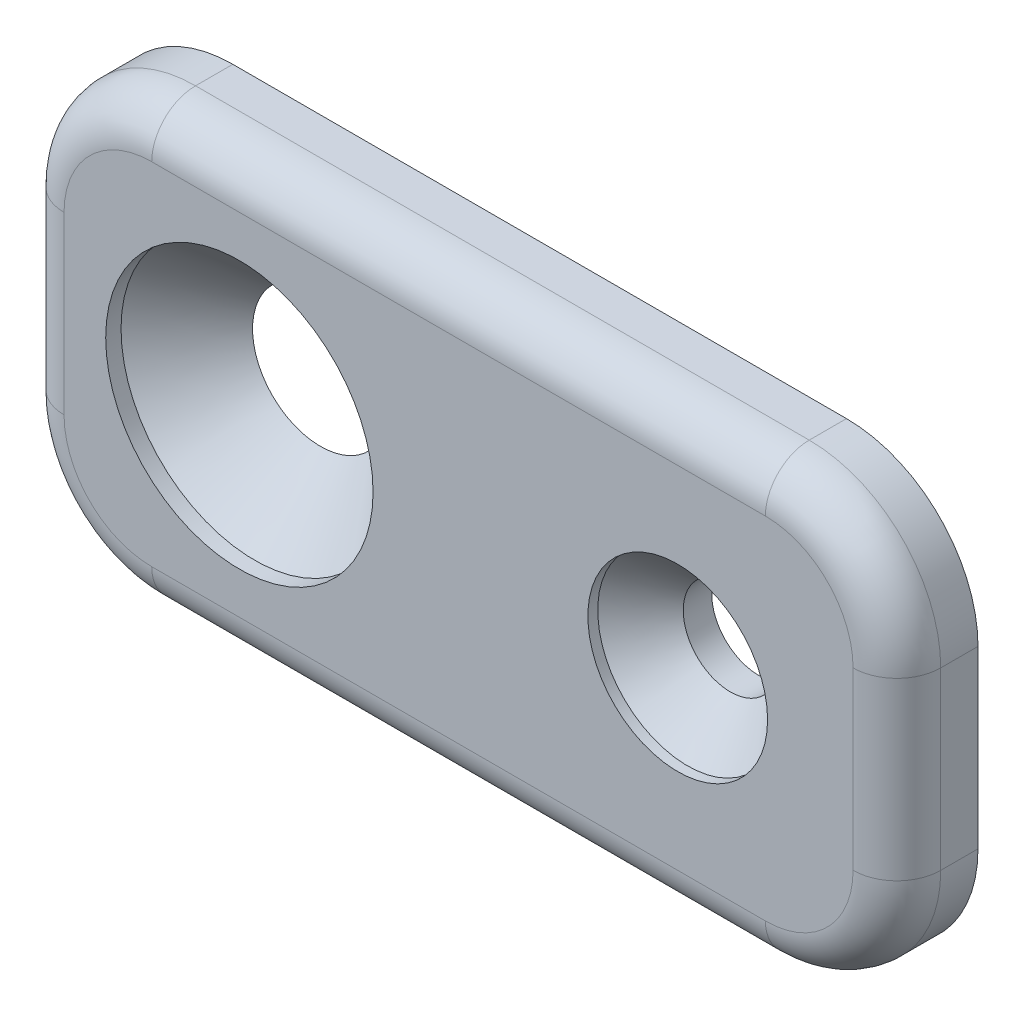
from build123d import *

# Parameters (mm, degrees)
SKETCH1_W           = 40
SKETCH1_H           = 20
SKETCH1_R           = 3.1
SKETCH1_R_2         = 2.15
BOSS_EXTRUDE1_DEPTH = 3.7
SKETCH2_R           = 6.1
CUT_EXTRUDE1_DEPTH  = 0.7
CHAMFER1_SIZE       = 3
SKETCH3_R           = 4.1
CUT_EXTRUDE2_DEPTH  = 0.4
CHAMFER2_SIZE       = 2
FILLET1_R           = 6
FILLET2_R           = 2


# Some blends are built 0.0001 mm under size
with BuildPart() as part:
    # Sketch1 → Boss-Extrude1 (new body)
    with BuildSketch(Plane.XY):
        with Locations((10, 0)):
            Rectangle(SKETCH1_W, SKETCH1_H)
        Circle(SKETCH1_R, mode=Mode.SUBTRACT)
        with Locations((20, 0)):
            Circle(SKETCH1_R_2, mode=Mode.SUBTRACT)
    extrude(amount=BOSS_EXTRUDE1_DEPTH)

    # Sketch2 → Cut-Extrude1 (cut)
    with BuildSketch(Plane.XY.offset(3.7)):
        Circle(SKETCH2_R)
    extrude(amount=-CUT_EXTRUDE1_DEPTH, mode=Mode.SUBTRACT)

    # Chamfer1
    chamfer1_edges = [part.edges().sort_by_distance(p)[0] for p in [
        (-3.1, 0, 3),
    ]]
    chamfer(chamfer1_edges, length=CHAMFER1_SIZE - 0.0001)  # a hair under: the kernel refuses the full size

    # Sketch3 → Cut-Extrude2 (cut)
    with BuildSketch(Plane.XY.offset(3.7)):
        with Locations((20, 0)):
            Circle(SKETCH3_R)
    extrude(amount=-CUT_EXTRUDE2_DEPTH, mode=Mode.SUBTRACT)

    # Chamfer2
    # the kernel refuses this chamfer: 2 mm, written as the material it takes off along each edge
    with BuildSketch(Plane(origin=(20, 0, 3.3), x_dir=(1, 0, 0), z_dir=(0, 1, 0))) as chamfer2_piece_1_section:
        Polygon((2.15, CHAMFER2_SIZE), (2.15 + CHAMFER2_SIZE, 0), (2.15, 0), align=None)
    chamfer2_piece_1 = revolve(axis=Axis((20, 0, 3.3), (0, 0, -1)), mode=Mode.PRIVATE)
    chamfer2_piece_1 = chamfer2_piece_1 & Plane(origin=(20, 0, 2.270614155), x_dir=(1, 0, 0), z_dir=(0, 0, 1)) * Cylinder(4.1, 17, mode=Mode.PRIVATE)
    add(chamfer2_piece_1, mode=Mode.SUBTRACT)

    # Fillet1
    fillet1_edges = [part.edges().sort_by_distance(p)[0] for p in [
        (-10, 10, 1.85),
        (30, 10, 1.85),
        (30, -10, 1.85),
        (-10, -10, 1.85),
    ]]
    fillet(fillet1_edges, radius=FILLET1_R)

    # Fillet2
    fillet2_edges = [part.edges().sort_by_distance(p)[0] for p in [
        (30, 0, 3.7),
        (10, -10, 3.7),
        (-10, 0, 3.7),
        (10, 10, 3.7),
        (-8.242640687, 8.242640687, 3.7),
        (28.242640687, 8.242640687, 3.7),
        (-8.242640687, -8.242640687, 3.7),
        (28.242640687, -8.242640687, 3.7),
    ]]
    fillet(fillet2_edges, radius=FILLET2_R)


solid = part.part
